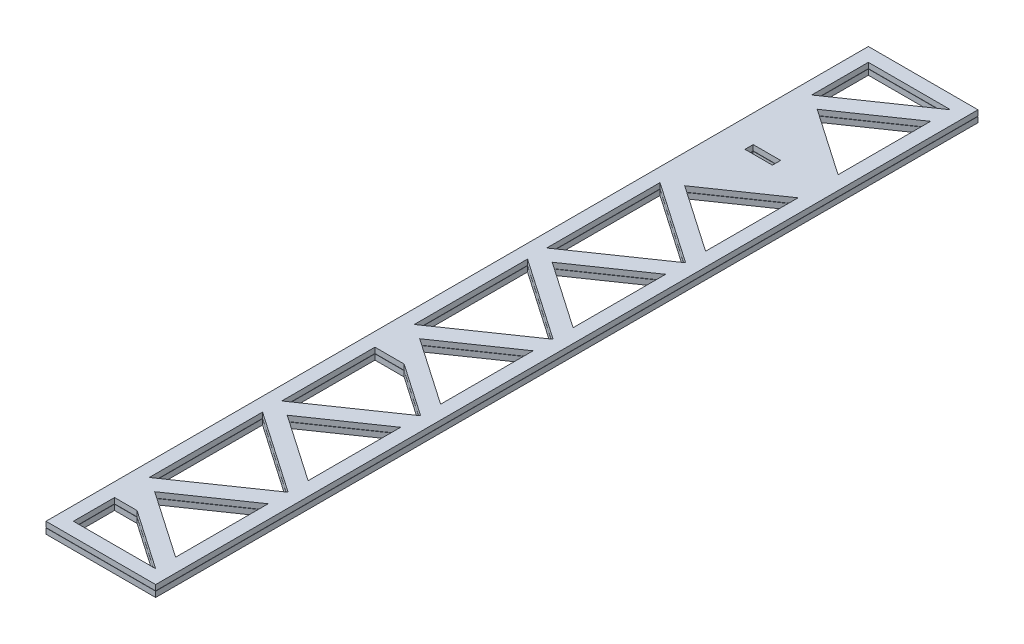
from build123d import *

# Parameters (mm, degrees)
SKETCH_2_W          = 40
SKETCH_2_H          = 2
EXTRUDE_1_DEPTH     = 300
EXTRUDE_1_2_DEPTH   = 300
CUT_EXTRUDE_1_DEPTH = 1076.662797098
SKETCH_4_W          = 10
SKETCH_4_H          = 3
CUT_EXTRUDE_2_DEPTH = 1076.662797098


with BuildPart() as part:
    # 草图2 → 凸台-拉伸1 (new body)
    with BuildSketch(Plane.XY.offset(762.01)):
        with Locations((150.787596038, -2.339694097)):
            Rectangle(SKETCH_2_W, SKETCH_2_H)
    extrude(amount=EXTRUDE_1_DEPTH)


with BuildPart() as body_2:
    # 草图2 → Extrude 1 2 (new body)
    with BuildSketch(Plane.XY.offset(762.01)):
        with Locations((150.787596038, -4.439694097)):
            Rectangle(SKETCH_2_W, SKETCH_2_H)
    extrude(amount=EXTRUDE_1_2_DEPTH)


with BuildPart() as cut_extrude_1_tool:
    # 草图3 → 切除-拉伸1 (new, through all)
    with BuildSketch(Plane(origin=(0, -1.339694097, 0), x_dir=(1, 0, 0), z_dir=(0, 1, 0))):
        Polygon((135.787596038, -1057.01), (165.787596038, -1057.01), (144.013402489, -1042.01), (135.787596038, -1042.01), align=None)
        Polygon((141.283267851, -1032.843333333), (165.787596038, -1049.724092751), (165.787596038, -1015.962573916), align=None)
        Polygon((135.787596038, -1029.343333333), (165.787596038, -1008.676666667), (135.787596038, -988.01), align=None)
        Polygon((141.283267851, -984.51), (165.787596038, -1001.390759417), (165.787596038, -967.629240583), align=None)
        Polygon((135.787596038, -947.01), (135.787596038, -981.01), (165.787596038, -960.343333333), (146.432757328, -947.01), align=None)
        Polygon((141.283267851, -936.176666667), (165.787596038, -953.057426084), (165.787596038, -919.295907249), align=None)
        Polygon((135.787596038, -891.343333333), (135.787596038, -932.676666667), (165.787596038, -912.01), align=None)
        Polygon((141.283267851, -887.843333333), (165.787596038, -904.724092751), (165.787596038, -870.962573916), align=None)
        Polygon((135.787596038, -843.01), (135.787596038, -884.343333333), (165.787596038, -863.676666667), align=None)
        Polygon((141.283267851, -839.51), (165.787596038, -856.390759417), (165.787596038, -822.629240583), align=None)
        Polygon((135.787596038, -767.01), (135.787596038, -787.676666667), (165.787596038, -767.01), align=None)
        Polygon((141.283267851, -791.176666667), (165.787596038, -808.057426084), (165.787596038, -774.295907249), align=None)
    extrude(amount=-CUT_EXTRUDE_1_DEPTH)


with BuildPart() as part_1:
    add(part.part)

    # 切除-拉伸1: cut by cut_extrude_1_tool
    add(cut_extrude_1_tool.part, mode=Mode.SUBTRACT)


with BuildPart() as body_2_1:
    add(body_2.part)

    # 切除-拉伸1: cut by cut_extrude_1_tool
    add(cut_extrude_1_tool.part, mode=Mode.SUBTRACT)


with BuildPart() as cut_extrude_2_tool:
    # 草图4 → 切除-拉伸2 (new, through all)
    with BuildSketch(Plane.XZ.offset(5.439694097)):
        with Locations((145.787596038, 815.51)):
            Rectangle(SKETCH_4_W, SKETCH_4_H)
    extrude(amount=-CUT_EXTRUDE_2_DEPTH)


with BuildPart() as part_2:
    add(part_1.part)

    # 切除-拉伸2: cut by cut_extrude_2_tool
    add(cut_extrude_2_tool.part, mode=Mode.SUBTRACT)


with BuildPart() as body_2_2:
    add(body_2_1.part)

    # 切除-拉伸2: cut by cut_extrude_2_tool
    add(cut_extrude_2_tool.part, mode=Mode.SUBTRACT)


solid = Compound([part_2.part, body_2_2.part])
